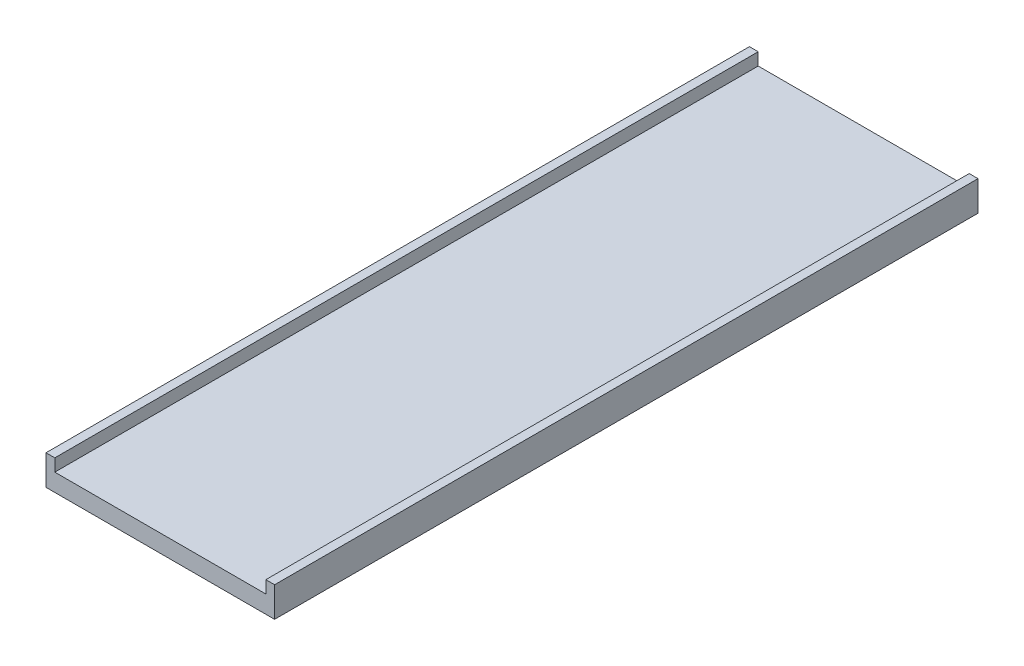
from build123d import *

# Parameters (mm, degrees)
BOSS_EXTRUDE1_DEPTH = 2000


with BuildPart() as part:
    # Sketch1 → Boss-Extrude1 (new body)
    with BuildSketch(Plane.XY):
        Polygon((0, 0), (25, 0), (25, -35.236081748), (625, -35.236081748), (625, 0), (650, 0), (650, -85.236081748), (0, -85.236081748), align=None)
    extrude(amount=BOSS_EXTRUDE1_DEPTH)


solid = part.part
